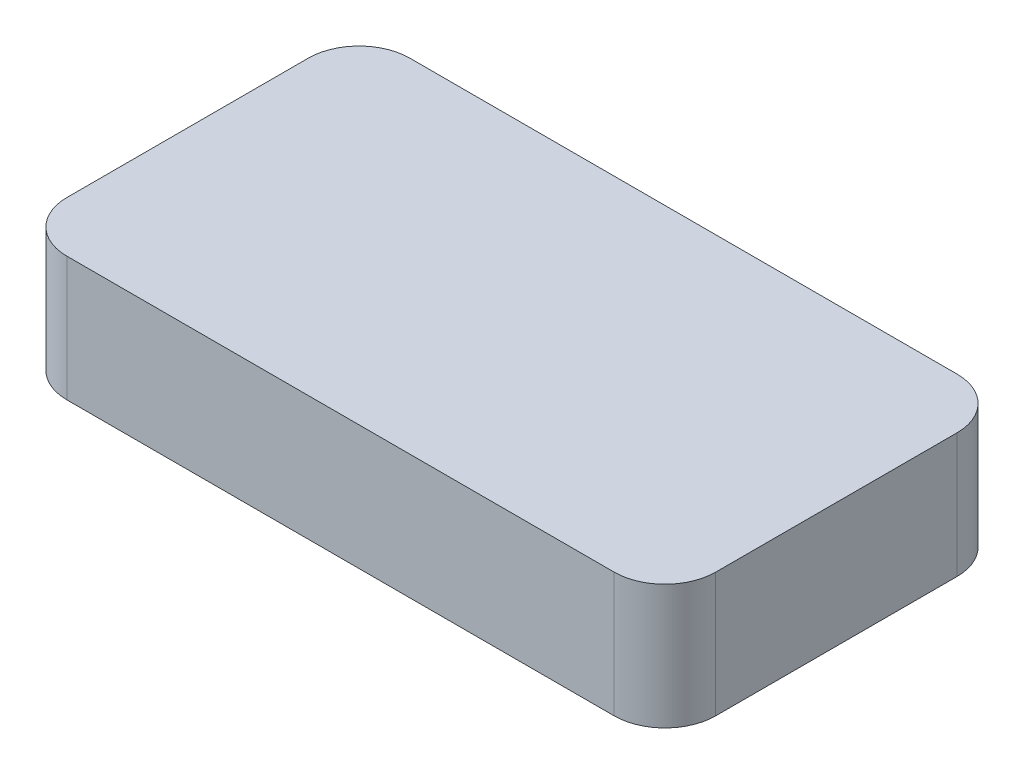
from build123d import *

# Parameters (mm, degrees)
SKETCH1_W           = 32.4358
SKETCH1_H           = 17.145
BOSS_EXTRUDE1_DEPTH = 6.223
FILLET1_R           = 2.54


with BuildPart() as part:
    # Sketch1 → Boss-Extrude1 (new body)
    with BuildSketch(Plane(origin=(0, 0, 0), x_dir=(1, 0, 0), z_dir=(0, 1, 0))):
        with Locations((16.2179, 8.5725)):
            Rectangle(SKETCH1_W, SKETCH1_H)
    extrude(amount=BOSS_EXTRUDE1_DEPTH)

    # Fillet1
    fillet1_edges = [part.edges().sort_by_distance(p)[0] for p in [
        (32.4358, 3.1115, -17.145),
        (32.4358, 3.1115, 0),
        (0, 3.1115, 0),
        (0, 3.1115, -17.145),
    ]]
    fillet(fillet1_edges, radius=FILLET1_R)


solid = part.part
